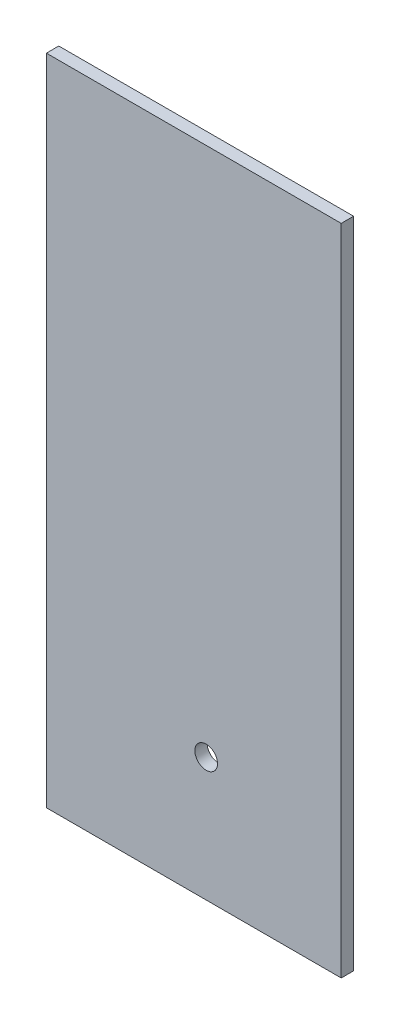
from build123d import *

# Parameters (mm, degrees)
SKETCH1_W           = 143
SKETCH1_H           = 317
BOSS_EXTRUDE1_DEPTH = 6
SKETCH2_R           = 5.5
CUT_EXTRUDE1_DEPTH  = 174.984194684


with BuildPart() as part:
    # Sketch1 → Boss-Extrude1 (new body)
    with BuildSketch(Plane.XY):
        Rectangle(SKETCH1_W, SKETCH1_H)
    extrude(amount=BOSS_EXTRUDE1_DEPTH)

    # Sketch2 → Cut-Extrude1 (cut, through all)
    with BuildSketch(Plane.XY.offset(6)):
        with Locations((6, -98.5)):
            Circle(SKETCH2_R)
    extrude(amount=-CUT_EXTRUDE1_DEPTH, mode=Mode.SUBTRACT)


solid = part.part
